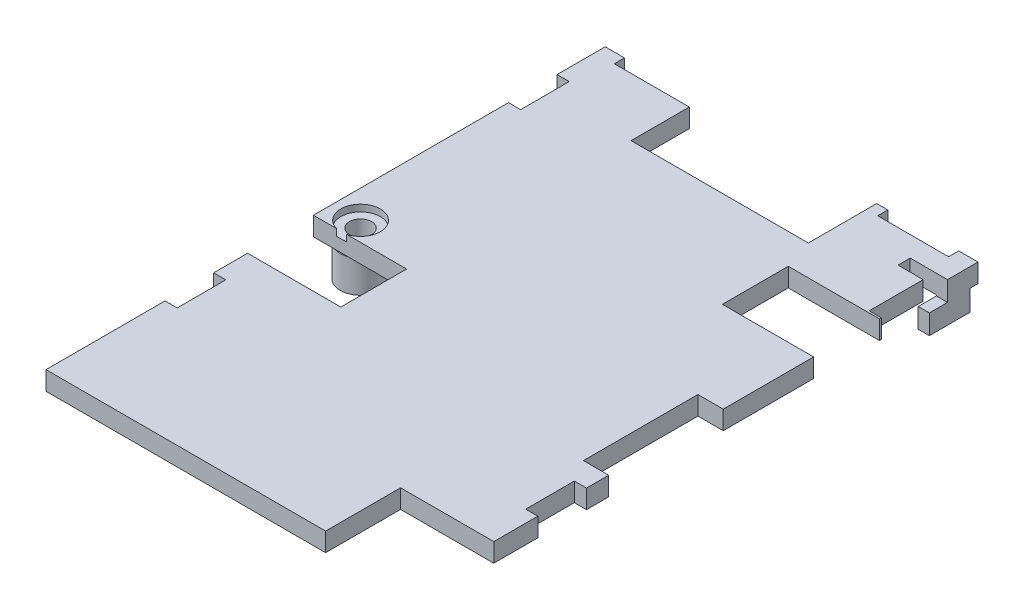
from build123d import *

# Parameters (mm, degrees)
TRAY_START                     = 4.75
SKETCH1_W                      = 36.8
SKETCH1_H                      = 55.2
TRAY_DEPTH                     = 1.85
S1_S3_START                    = 4.65
SKETCH2_W                      = 9.25
SKETCH2_H                      = 6.5
SKETCH2_W_2                    = 9.05
SKETCH2_H_2                    = 7.5
S1_S3_AND_PLUGS_DEPTH          = 2.05
J4_START                       = 4.65
SKETCH3_W                      = 17.5
SKETCH3_H                      = 6.85
J4_AND_ITS_FLEX_DEPTH          = 2.05
BATTERY_START                  = 4.65
SKETCH4_W                      = 2.6
SKETCH4_H                      = 11.3
BATTERY_AND_NTC_PAD_SLOT_DEPTH = 2.05
ALIGNMENT_START                = 2.7
SKETCH5_W                      = 1.1
SKETCH5_H                      = 4
ALIGNMENT_RAILS_DEPTH          = 2.06
BOARD_START                    = 1.6
SKETCH6_R                      = 2
BOARD_SCREW_FOOT_DEPTH         = 3.16
BOARD_START_2                  = 1.5
SKETCH7_R                      = 1.1
BOARD_SCREW_HOLE_DEPTH         = 5.2
BOARD_START_3                  = 5.94
SKETCH8_R                      = 1.95
BOARD_SCREW_COUNTERBORE_DEPTH  = 0.76
MIC_START                      = 4.65
SKETCH9_W                      = 3.78
SKETCH9_H                      = 1.2
MIC_SLOT_DEPTH                 = 2.05
SNAP_START                     = 4.65
SKETCH10_W                     = 1.3
SKETCH10_H                     = 6.54
SKETCH10_H_2                   = 4.8
SKETCH10_W_2                   = 7
SKETCH10_H_3                   = 1.1
SKETCH10_W_3                   = 7.5
SNAP_CLIP_ROOM_DEPTH           = 2.05


with BuildPart() as part:
    # Sketch1 → Tray (new body)
    with BuildSketch(Plane(origin=(0, 0, 0), x_dir=(1, 0, 0), z_dir=(0, 1, 0)).offset(TRAY_START)):
        with Locations((0, 5.95)):
            Rectangle(SKETCH1_W, SKETCH1_H)
    extrude(amount=TRAY_DEPTH)

    # Sketch2 → S1-S3 and plugs (cut)
    with BuildSketch(Plane(origin=(0, 0, 0), x_dir=(1, 0, 0), z_dir=(0, 1, 0)).offset(S1_S3_START)):
        with Locations((-13.825, 1.5)):
            Rectangle(SKETCH2_W, SKETCH2_H)
        with Locations((13.925, 20.57)):
            Rectangle(SKETCH2_W_2, SKETCH2_H)
        with Locations((13.825, -18)):
            Rectangle(SKETCH2_W, SKETCH2_H_2)
    extrude(amount=S1_S3_AND_PLUGS_DEPTH, mode=Mode.SUBTRACT)

    # Sketch3 → J4 and its flex (cut)
    with BuildSketch(Plane(origin=(0, 0, 0), x_dir=(1, 0, 0), z_dir=(0, 1, 0)).offset(J4_START)):
        with Locations((-0.35, 30.225)):
            Rectangle(SKETCH3_W, SKETCH3_H)
    extrude(amount=J4_AND_ITS_FLEX_DEPTH, mode=Mode.SUBTRACT)

    # Sketch4 → Battery and NTC pad slot (cut)
    with BuildSketch(Plane(origin=(0, 0, 0), x_dir=(1, 0, 0), z_dir=(0, 1, 0)).offset(BATTERY_START)):
        with Locations((17.2, 2.75)):
            Rectangle(SKETCH4_W, SKETCH4_H)
    extrude(amount=BATTERY_AND_NTC_PAD_SLOT_DEPTH, mode=Mode.SUBTRACT)

    # Sketch5 → Alignment rails (add)
    with BuildSketch(Plane(origin=(0, 0, 0), x_dir=(1, 0, 0), z_dir=(0, 1, 0)).offset(ALIGNMENT_START)):
        with Locations((17.85, 30.75)):
            Rectangle(SKETCH5_W, SKETCH5_H)
        with Locations((-17.85, 30.75)):
            Rectangle(SKETCH5_W, SKETCH5_H)
    extrude(amount=ALIGNMENT_RAILS_DEPTH)

    # Sketch6 → Board screw foot (add)
    with BuildSketch(Plane(origin=(0, 0, 0), x_dir=(1, 0, 0), z_dir=(0, 1, 0)).offset(BOARD_START)):
        with Locations((-15.64, 6.64)):
            Circle(SKETCH6_R)
    extrude(amount=BOARD_SCREW_FOOT_DEPTH)

    # Sketch7 → Board screw hole (cut)
    with BuildSketch(Plane(origin=(0, 0, 0), x_dir=(1, 0, 0), z_dir=(0, 1, 0)).offset(BOARD_START_2)):
        with Locations((-15.64, 6.64)):
            Circle(SKETCH7_R)
    extrude(amount=BOARD_SCREW_HOLE_DEPTH, mode=Mode.SUBTRACT)

    # Sketch8 → Board screw counterbore (cut)
    with BuildSketch(Plane(origin=(0, 0, 0), x_dir=(1, 0, 0), z_dir=(0, 1, 0)).offset(BOARD_START_3)):
        with Locations((-15.64, 6.64)):
            Circle(SKETCH8_R)
    extrude(amount=BOARD_SCREW_COUNTERBORE_DEPTH, mode=Mode.SUBTRACT)

    # Sketch9 → Mic slot (cut)
    with BuildSketch(Plane(origin=(0, 0, 0), x_dir=(1, 0, 0), z_dir=(0, 1, 0)).offset(MIC_START)):
        with Locations((16.61, 29.94)):
            Rectangle(SKETCH9_W, SKETCH9_H)
    extrude(amount=MIC_SLOT_DEPTH, mode=Mode.SUBTRACT)

    # Sketch10 → Snap clip room (cut)
    with BuildSketch(Plane(origin=(0, 0, 0), x_dir=(1, 0, 0), z_dir=(0, 1, 0)).offset(SNAP_START)):
        with Locations((17.85, 27.27)):
            Rectangle(SKETCH10_W, SKETCH10_H)
        with Locations((-17.85, 26.4)):
            Rectangle(SKETCH10_W, SKETCH10_H_2)
        with Locations((17.85, -7.5)):
            Rectangle(SKETCH10_W, SKETCH10_H_2)
        with Locations((-17.85, -7.5)):
            Rectangle(SKETCH10_W, SKETCH10_H_2)
        with Locations((13, 33.1)):
            Rectangle(SKETCH10_W_2, SKETCH10_H_3)
        with Locations((-12.75, 33.1)):
            Rectangle(SKETCH10_W_3, SKETCH10_H_3)
    extrude(amount=SNAP_CLIP_ROOM_DEPTH, mode=Mode.SUBTRACT)


solid = part.part
